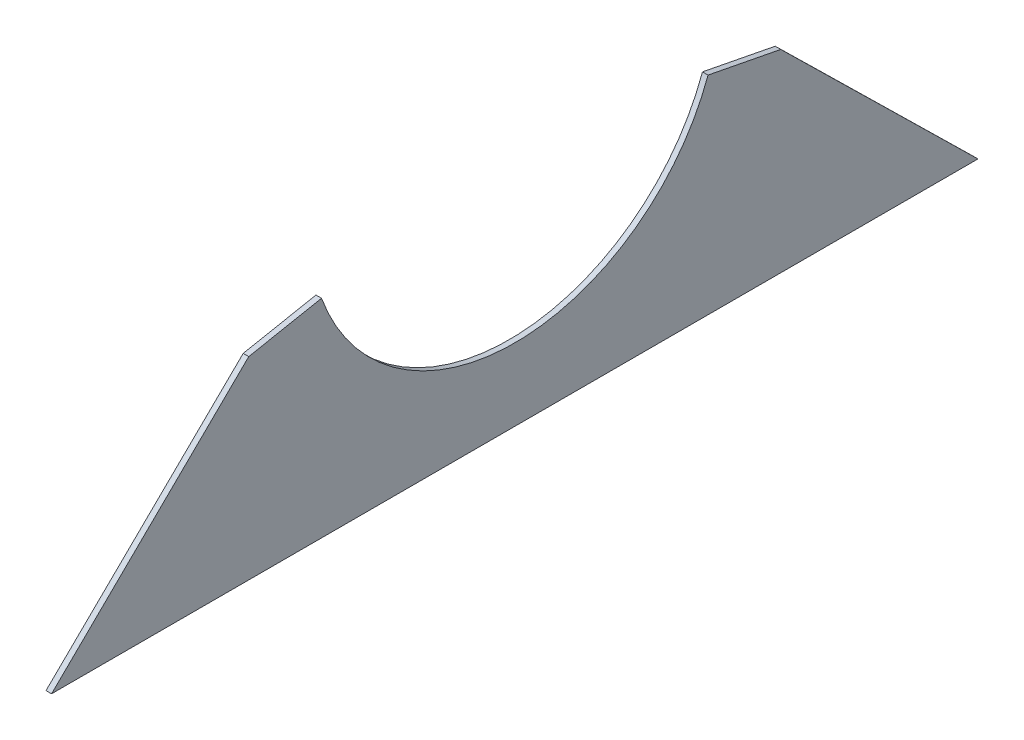
from build123d import *

# Parameters (mm, degrees)
SM_BASE_FLANGE_1_DEPTH = 3


# Sheet-metal steps are written as plain solids
with BuildPart() as part:
    # Sketch 1 → Базовая кромка1 (new body)
    with BuildSketch(Plane(origin=(0, 0, 0), x_dir=(0, 0, -1), z_dir=(1, 0, 0))):
        with BuildLine():
            Line((250, -150), (-250, -150))
            Line((-250, -150), (-143.570968245, -45.596595724))
            Line((-143.570968245, -45.596595724), (-104.305880907, -37.964235909))
            ThreePointArc((-104.305880907, -37.964235909), (0, -111), (104.305880907, -37.964235909))
            Line((104.305880907, -37.964235909), (143.570968245, -45.596595724))
            Line((143.570968245, -45.596595724), (250, -150))
        make_face()
    extrude(amount=-SM_BASE_FLANGE_1_DEPTH)


solid = part.part
